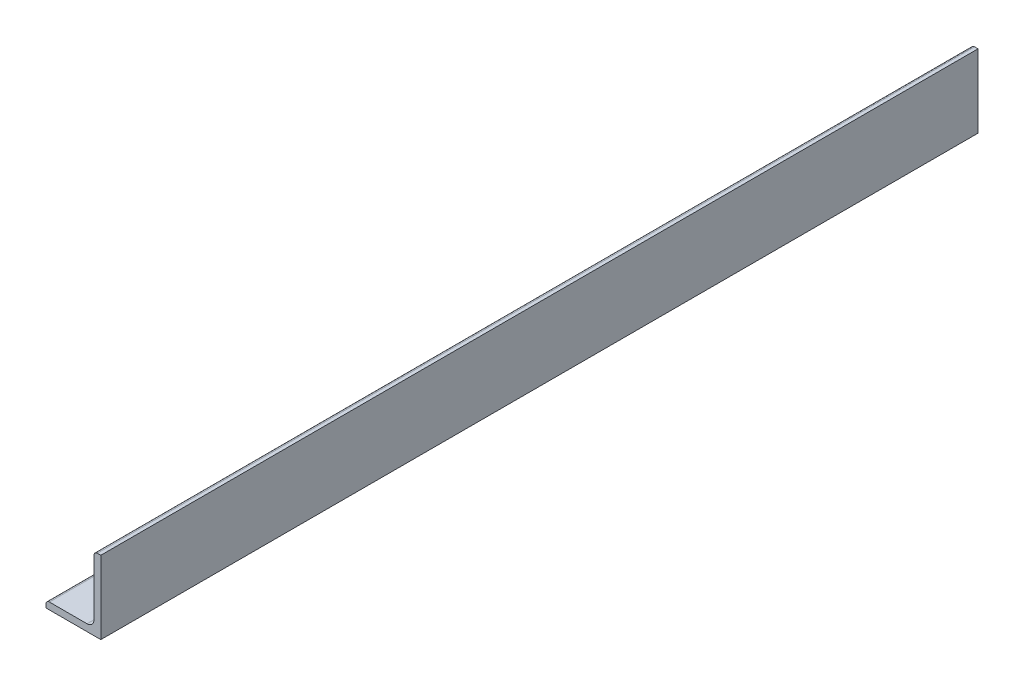
from build123d import *

# Parameters (mm, degrees)
BOSS_EXTRUDE1_DEPTH = 304.8


with BuildPart() as part:
    # Sketch2 → Boss-Extrude1 (new, symmetric)
    with BuildSketch(Plane.XY):
        with BuildLine():
            Line((-19.05, -25.4), (19.05, -25.4))
            Line((19.05, -25.4), (19.05, 25.4))
            Line((19.05, 25.4), (16.6624, 25.4))
            ThreePointArc((16.6624, 25.4), (14.974111849, 24.700688151), (14.2748, 23.0124))
            Line((14.2748, 23.0124), (14.2748, -15.8496))
            ThreePointArc((14.2748, -15.8496), (12.876176302, -19.226176302), (9.4996, -20.6248))
            Line((9.4996, -20.6248), (-16.6624, -20.6248))
            ThreePointArc((-16.6624, -20.6248), (-18.350688151, -21.324111849), (-19.05, -23.0124))
            Line((-19.05, -23.0124), (-19.05, -25.4))
        make_face()
    extrude(amount=BOSS_EXTRUDE1_DEPTH, both=True)


solid = part.part
